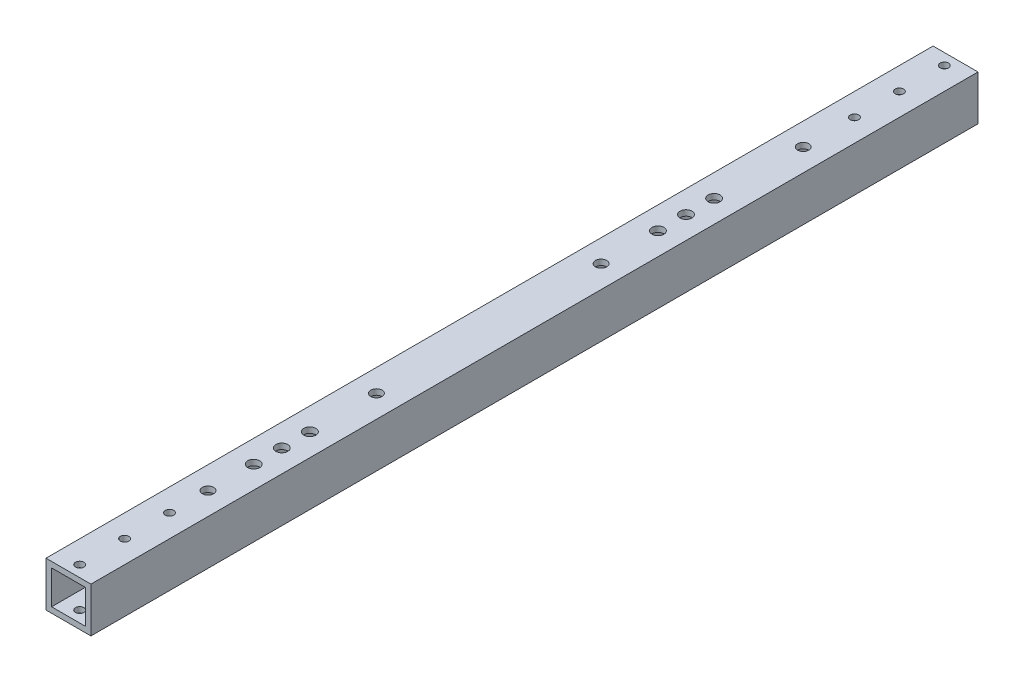
from build123d import *

# Parameters (mm, degrees)
SKETCH1_W                       = 25.4
SKETCH1_H                       = 25.4
SKETCH1_W_2                     = 19.05
SKETCH1_H_2                     = 19.05
EXTRUDE_THIN1_DEPTH             = 501.65
F_3_16_0_1875_DIAMETER_HOLE1_D  = 4.7625
F_1_4_0_25_DIAMETER_HOLE1_D     = 6.35
F_1_4_0_25_DIAMETER_HOLE1_DEPTH = 25.4
F_1_4_0_25_DIAMETER_HOLE1_TIP   = 1.907732465
F_1_4_CLEARANCE_HOLE1_D         = 6.7564
F_1_4_CLEARANCE_HOLE1_DEPTH     = 38.1
F_1_4_CLEARANCE_HOLE1_TIP       = 2.029827343


with BuildPart() as part:
    # Sketch1 → Extrude-Thin1 (new body)
    with BuildSketch(Plane.XY):
        Rectangle(SKETCH1_W, SKETCH1_H)
        Rectangle(SKETCH1_W_2, SKETCH1_H_2, mode=Mode.SUBTRACT)
    extrude(amount=EXTRUDE_THIN1_DEPTH)

    # 3/16 (0.1875) Diameter Hole1 (through all)
    with Locations(Plane(origin=(0, 12.7, 495.3), x_dir=(0, 0, 1), z_dir=(0, 1, 0))):
        with Locations((0, 0), (-488.95, 0), (-463.55, 0), (-438.15, 0), (-25.4, 0), (-50.8, 0)):
            Hole(F_3_16_0_1875_DIAMETER_HOLE1_D / 2)

    # 1/4 (0.25) Diameter Hole1
    with Locations(Plane(origin=(0, 12.7, 0), x_dir=(1, 0, 0), z_dir=(0, 1, 0))):
        with Locations((0, -200.464463093), (0, -422.731), (0, -327.481), (0, -86.154539829)):
            Hole(F_1_4_0_25_DIAMETER_HOLE1_D / 2, depth=F_1_4_0_25_DIAMETER_HOLE1_DEPTH)
            with Locations((0, 0, -(F_1_4_0_25_DIAMETER_HOLE1_DEPTH + F_1_4_0_25_DIAMETER_HOLE1_TIP / 2))):  # 118° drill point
                Cone(0, F_1_4_0_25_DIAMETER_HOLE1_D / 2, F_1_4_0_25_DIAMETER_HOLE1_TIP, mode=Mode.SUBTRACT)

    # 1/4 Clearance Hole1
    with Locations(Plane(origin=(-381, 12.7, 250.825), x_dir=(1, 0, 0), z_dir=(0, 1, 0))):
        with Locations((381, 82.55), (381, 98.425), (381, 114.3), (381, -146.05), (381, -130.175), (381, -114.3), (-381, -146.05), (-381, -130.175), (-381, -114.3), (-381, 82.55), (-381, 98.425), (-381, 114.3)):
            Hole(F_1_4_CLEARANCE_HOLE1_D / 2, depth=F_1_4_CLEARANCE_HOLE1_DEPTH)
            with Locations((0, 0, -(F_1_4_CLEARANCE_HOLE1_DEPTH + F_1_4_CLEARANCE_HOLE1_TIP / 2))):  # 118° drill point
                Cone(0, F_1_4_CLEARANCE_HOLE1_D / 2, F_1_4_CLEARANCE_HOLE1_TIP, mode=Mode.SUBTRACT)


solid = part.part
